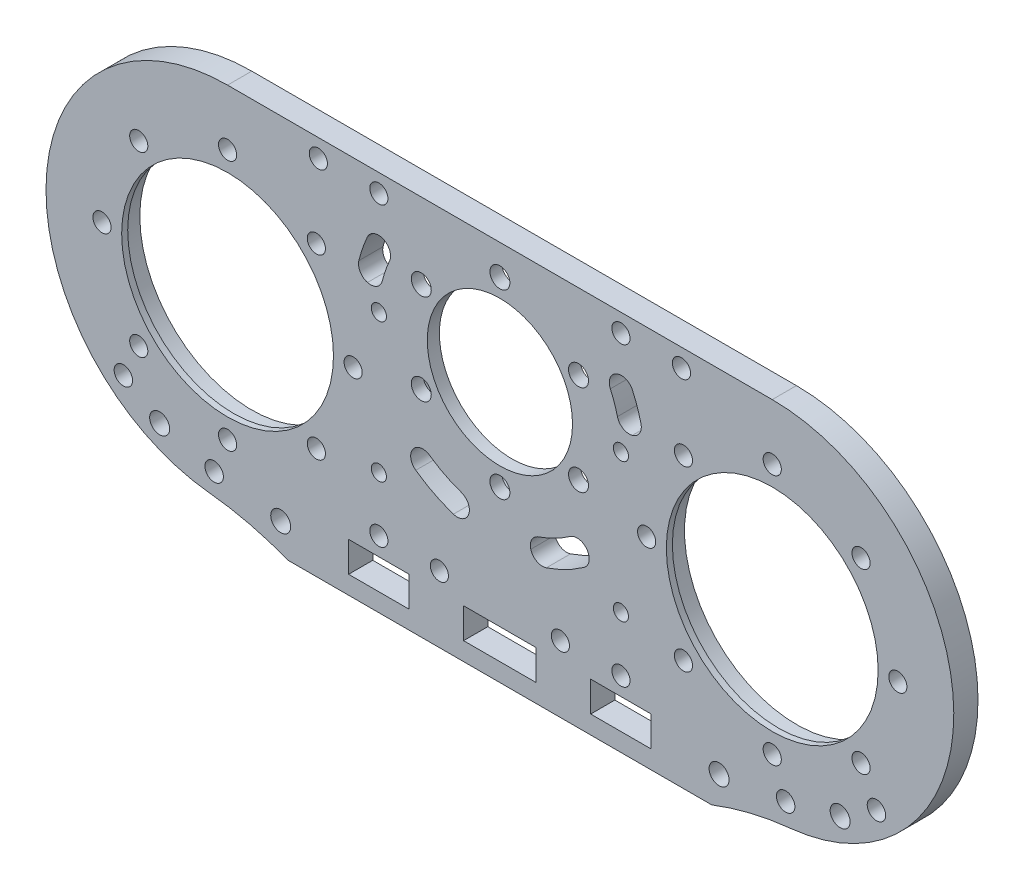
from build123d import *

# Parameters (mm, degrees)
SKETCH_1_R           = 1.5
SKETCH_1_R_2         = 17.5
SKETCH_1_R_3         = 12
SKETCH_1_R_4         = 1.25
EXTRUDE_1_DEPTH      = 4
SKETCH_2_R           = 18.5
SKETCH_2_R_2         = 17.5
CUT_EXTRUDE_1_DEPTH  = 3
SKETCH_3_W           = 10
SKETCH_3_H           = 5
SKETCH_3_W_2         = 6
CUT_EXTRUDE_2_DEPTH  = 93.020070098
CUT_EXTRUDE_3_DEPTH  = 93.020070098
FILLET_2_R           = 2
SKETCH_6_R           = 1.25
CUT_EXTRUDE_5_DEPTH  = 10
SKETCH_7_R           = 1.65
CUT_EXTRUDE_6_DEPTH  = 10
SKETCH_9_R           = 1.65
CUT_EXTRUDE_7_DEPTH  = 10
SKETCH_10_R          = 17.5
SKETCH_10_R_2        = 10.270750689
CUT_EXTRUDE_8_DEPTH  = 2
SKETCH_11_R          = 1.5
CUT_EXTRUDE_9_DEPTH  = 10
SKETCH_12_R          = 1.525
CUT_EXTRUDE_10_DEPTH = 10


with BuildPart() as part:
    # 草图1 → 凸台-拉伸1 (new body)
    with BuildSketch(Plane.XY):
        with BuildLine():
            Line((-27.534883443, -40.634933888), (42.465116557, -40.634933888))
            ThreePointArc((42.465116557, -40.634933888), (48.890398145, -38.615583047), (55.528781273, -37.478089862))
            ThreePointArc((55.528781273, -37.478089862), (82.425879892, -6.10109544), (52.465116557, 22.365066112))
            Line((52.465116557, 22.365066112), (-37.534883443, 22.365066112))
            ThreePointArc((-37.534883443, 22.365066112), (-67.495646778, -6.10109544), (-40.598548158, -37.478089862))
            ThreePointArc((-40.598548158, -37.478089862), (-33.960165031, -38.615583047), (-27.534883443, -40.634933888))
        make_face()
        with Locations((52.465116557, 13.115066112)):
            Circle(SKETCH_1_R, mode=Mode.SUBTRACT)
        with Locations((67.137582267, 7.037531822)):
            Circle(SKETCH_1_R, mode=Mode.SUBTRACT)
        with Locations((73.215116557, -7.634933888)):
            Circle(SKETCH_1_R, mode=Mode.SUBTRACT)
        with Locations((67.137582267, -22.307399597)):
            Circle(SKETCH_1_R, mode=Mode.SUBTRACT)
        with Locations((52.465116557, -28.384933888)):
            Circle(SKETCH_1_R, mode=Mode.SUBTRACT)
        with Locations((37.792650848, -22.307399597)):
            Circle(SKETCH_1_R, mode=Mode.SUBTRACT)
        with Locations((31.715116557, -7.634933888)):
            Circle(SKETCH_1_R, mode=Mode.SUBTRACT)
        with Locations((37.792650848, 7.037531822)):
            Circle(SKETCH_1_R, mode=Mode.SUBTRACT)
        with Locations(Location((-22.862417733, 7.037531822, 0), (0, 0, 180))):
            Circle(SKETCH_1_R, mode=Mode.SUBTRACT)
        with Locations(Location((-16.784883443, -7.634933888, 0), (0, 0, 180))):
            Circle(SKETCH_1_R, mode=Mode.SUBTRACT)
        with Locations(Location((-22.862417733, -22.307399597, 0), (0, 0, 180))):
            Circle(SKETCH_1_R, mode=Mode.SUBTRACT)
        with Locations(Location((-37.534883443, -28.384933888, 0), (0, 0, 180))):
            Circle(SKETCH_1_R, mode=Mode.SUBTRACT)
        with Locations(Location((-52.207349152, -22.307399597, 0), (0, 0, 180))):
            Circle(SKETCH_1_R, mode=Mode.SUBTRACT)
        with Locations(Location((-58.284883443, -7.634933888, 0), (0, 0, 180))):
            Circle(SKETCH_1_R, mode=Mode.SUBTRACT)
        with Locations(Location((-52.207349152, 7.037531822, 0), (0, 0, 180))):
            Circle(SKETCH_1_R, mode=Mode.SUBTRACT)
        with Locations(Location((-37.534883443, 13.115066112, 0), (0, 0, 180))):
            Circle(SKETCH_1_R, mode=Mode.SUBTRACT)
        with Locations((52.465116557, -7.634933888)):
            Circle(SKETCH_1_R_2, mode=Mode.SUBTRACT)
        with Locations(Location((-37.534883443, -7.634933888, 0), (0, 0, 180))):
            Circle(SKETCH_1_R_2, mode=Mode.SUBTRACT)
        with Locations((7.465116557, 2.365066112)):
            Circle(SKETCH_1_R_3, mode=Mode.SUBTRACT)
        with Locations((37.465116557, 19.365066112)):
            Circle(SKETCH_1_R, mode=Mode.SUBTRACT)
        with Locations((27.465116557, 19.365066112)):
            Circle(SKETCH_1_R, mode=Mode.SUBTRACT)
        with Locations(Location((-22.534883443, 19.365066112, 0), (0, 0, 180))):
            Circle(SKETCH_1_R, mode=Mode.SUBTRACT)
        with Locations(Location((-12.534883443, 19.365066112, 0), (0, 0, 180))):
            Circle(SKETCH_1_R, mode=Mode.SUBTRACT)
        with Locations((27.465116557, 2.365066112)):
            Circle(SKETCH_1_R_4, mode=Mode.SUBTRACT)
        with Locations(Location((-12.534883443, 2.365066112, 0), (0, 0, 180))):
            Circle(SKETCH_1_R_4, mode=Mode.SUBTRACT)
    extrude(amount=EXTRUDE_1_DEPTH)

    # 草图2 → 切除-拉伸1 (cut)
    # profile 1 of 2: a face of its own
    with BuildSketch(Plane.XY):
        with Locations((52.465116557, -7.634933888)):
            Circle(SKETCH_2_R)
        with Locations((52.465116557, -7.634933888)):
            Circle(SKETCH_2_R_2, mode=Mode.SUBTRACT)
    # profile 2 of 2: a face of its own
    with BuildSketch(Plane.XY):
        with Locations(Location((-37.534883443, -7.634933888, 0), (0, 0, 180))):
            Circle(SKETCH_2_R)
        with Locations(Location((-37.534883443, -7.634933888, 0), (0, 0, 180))):
            Circle(SKETCH_2_R_2, mode=Mode.SUBTRACT)
    extrude(amount=CUT_EXTRUDE_1_DEPTH, mode=Mode.SUBTRACT)

    # 草图3 → 切除-拉伸2 (cut, through all)
    with BuildSketch(Plane(origin=(0, 0, 0), x_dir=(-1, 0, 0), z_dir=(0, 0, -1))):
        with Locations((-27.465116557, -35.134933888)):
            Rectangle(SKETCH_3_W, SKETCH_3_H)
        with Locations((-10.465116557, -35.134933888)):
            Rectangle(SKETCH_3_W_2, SKETCH_3_H)
        with Locations((-4.465116557, -35.134933888)):
            Rectangle(SKETCH_3_W_2, SKETCH_3_H)
        with Locations((12.534883443, -35.134933888)):
            Rectangle(SKETCH_3_W, SKETCH_3_H)
    extrude(amount=-CUT_EXTRUDE_2_DEPTH, mode=Mode.SUBTRACT)

    # 草图4 → 切除-拉伸3 (cut, through all)
    with BuildSketch(Plane.XY.offset(4)):
        with BuildLine():
            Line((-5.446700673, -12.908603251), (-8.283381868, -15.745284446))
            ThreePointArc((-8.283381868, -15.745284446), (-3.541787321, -18.962101234), (1.82717455, -20.963320243))
            Line((1.82717455, -20.963320243), (2.862828881, -17.098205662))
            ThreePointArc((2.862828881, -17.098205662), (-1.539002487, -15.493428792), (-5.446700673, -12.908603251))
        make_face()
        with BuildLine():
            Line((20.391590305, -12.896201085), (23.228082643, -15.732693423))
            ThreePointArc((23.228082643, -15.732693423), (18.476716566, -18.959676916), (13.094689736, -20.96534121))
            Line((13.094689736, -20.96534121), (12.059024323, -17.100185272))
            ThreePointArc((12.059024323, -17.100185272), (16.473962924, -15.491044526), (20.391590305, -12.896201085))
        make_face()
        with BuildLine():
            Line((24.9885745, 12.005004999), (28.281142659, 14.310486044))
            ThreePointArc((28.281142659, 14.310486044), (30.089876696, 10.372576877), (31.161002411, 6.173608298))
            Line((31.161002411, 6.173608298), (27.272825293, 5.131774379))
            ThreePointArc((27.272825293, 5.131774379), (26.444429669, 8.672654702), (24.9885745, 12.005004999))
        make_face()
        with BuildLine():
            Line((-10.050135089, 12.019907372), (-13.342451817, 14.325212363))
            ThreePointArc((-13.342451817, 14.325212363), (-15.15680913, 10.380580957), (-16.230769297, 6.173608298))
            Line((-16.230769297, 6.173608298), (-12.342592179, 5.131774379))
            ThreePointArc((-12.342592179, 5.131774379), (-11.511512147, 8.680726255), (-10.050135089, 12.019907372))
        make_face()
    extrude(amount=-CUT_EXTRUDE_3_DEPTH, mode=Mode.SUBTRACT)

    # 圆角2
    fillet_2_edges = [part.edges().sort_by_distance(p)[0] for p in [
        (-10.050135089, 12.019907372, 2),
        (-12.342592179, 5.131774379, 2),
        (-16.230769297, 6.173608298, 2),
        (-13.342451817, 14.325212363, 2),
        (-5.446700673, -12.908603251, 2),
        (-8.283381868, -15.745284446, 2),
        (24.9885745, 12.005004999, 2),
        (27.272825293, 5.131774379, 2),
        (31.161002411, 6.173608298, 2),
        (28.281142659, 14.310486044, 2),
        (23.228082643, -15.732693423, 2),
        (20.391590305, -12.896201085, 2),
        (13.094689736, -20.96534121, 2),
        (12.059024323, -17.100185272, 2),
        (2.862828881, -17.098205662, 2),
        (1.82717455, -20.963320243, 2),
    ]]
    fillet(fillet_2_edges, radius=FILLET_2_R - 0.0001)  # a hair under: the kernel refuses the full size

    # 草图6 → 切除-拉伸5 (cut)
    with BuildSketch(Plane.XY.offset(4)):
        with Locations((-12.534883443, -20.571755315)):
            Circle(SKETCH_6_R)
        with Locations((27.465116557, -20.571755315)):
            Circle(SKETCH_6_R)
    extrude(amount=-CUT_EXTRUDE_5_DEPTH, mode=Mode.SUBTRACT)

    # 草图7 → 切除-拉伸6 (cut)
    with BuildSketch(Plane.XY.offset(4)):
        with Locations((43.683121449, -35.634933888)):
            Circle(SKETCH_7_R)
        with Locations((63.683121449, -31.634933888)):
            Circle(SKETCH_7_R)
        with Locations((-48.752888335, -31.634933888)):
            Circle(SKETCH_7_R)
        with Locations((-28.752888335, -35.634933888)):
            Circle(SKETCH_7_R)
    extrude(amount=-CUT_EXTRUDE_6_DEPTH, mode=Mode.SUBTRACT)

    # 草图9 → 切除-拉伸7 (cut)
    with BuildSketch(Plane.XY.offset(4)):
        with Locations((7.465116557, 17.365066112)):
            Circle(SKETCH_9_R)
        with Locations((20.455497614, 9.865066112)):
            Circle(SKETCH_9_R)
        with Locations((20.455497614, -5.134933888)):
            Circle(SKETCH_9_R)
        with Locations((7.465116557, -12.634933888)):
            Circle(SKETCH_9_R)
        with Locations((-5.5252645, -5.134933888)):
            Circle(SKETCH_9_R)
        with Locations((-5.5252645, 9.865066112)):
            Circle(SKETCH_9_R)
    extrude(amount=-CUT_EXTRUDE_7_DEPTH, mode=Mode.SUBTRACT)

    # 草图10 → 切除-拉伸8 (cut)
    with BuildSketch(Plane.XY):
        with Locations((7.465116557, 2.365066112)):
            Circle(SKETCH_10_R)
        with Locations((7.465116557, 2.365066112)):
            Circle(SKETCH_10_R_2, mode=Mode.SUBTRACT)
    extrude(amount=CUT_EXTRUDE_8_DEPTH, mode=Mode.SUBTRACT)

    # 草图11 → 切除-拉伸9 (cut)
    with BuildSketch(Plane.XY.offset(4)):
        with Locations((17.465116557, -29.634933888)):
            Circle(SKETCH_11_R)
        with Locations((27.465116557, -29.634933888)):
            Circle(SKETCH_11_R)
        with Locations((-12.534883443, -29.634933888)):
            Circle(SKETCH_11_R)
        with Locations((-2.534883443, -29.634933888)):
            Circle(SKETCH_11_R)
    extrude(amount=-CUT_EXTRUDE_9_DEPTH, mode=Mode.SUBTRACT)

    # 草图12 → 切除-拉伸10 (cut)
    with BuildSketch(Plane(origin=(0, 0, 0), x_dir=(-1, 0, 0), z_dir=(0, 0, -1))):
        with Locations((39.752888335, -34.034253729)):
            Circle(SKETCH_12_R)
        with Locations((54.752888335, -27.769082524)):
            Circle(SKETCH_12_R)
        with Locations(Location((-69.683121449, -27.769082524, 0), (0, 0, 180))):
            Circle(SKETCH_12_R)
        with Locations(Location((-54.683121449, -34.034253729, 0), (0, 0, 180))):
            Circle(SKETCH_12_R)
    extrude(amount=-CUT_EXTRUDE_10_DEPTH, mode=Mode.SUBTRACT)


solid = part.part
